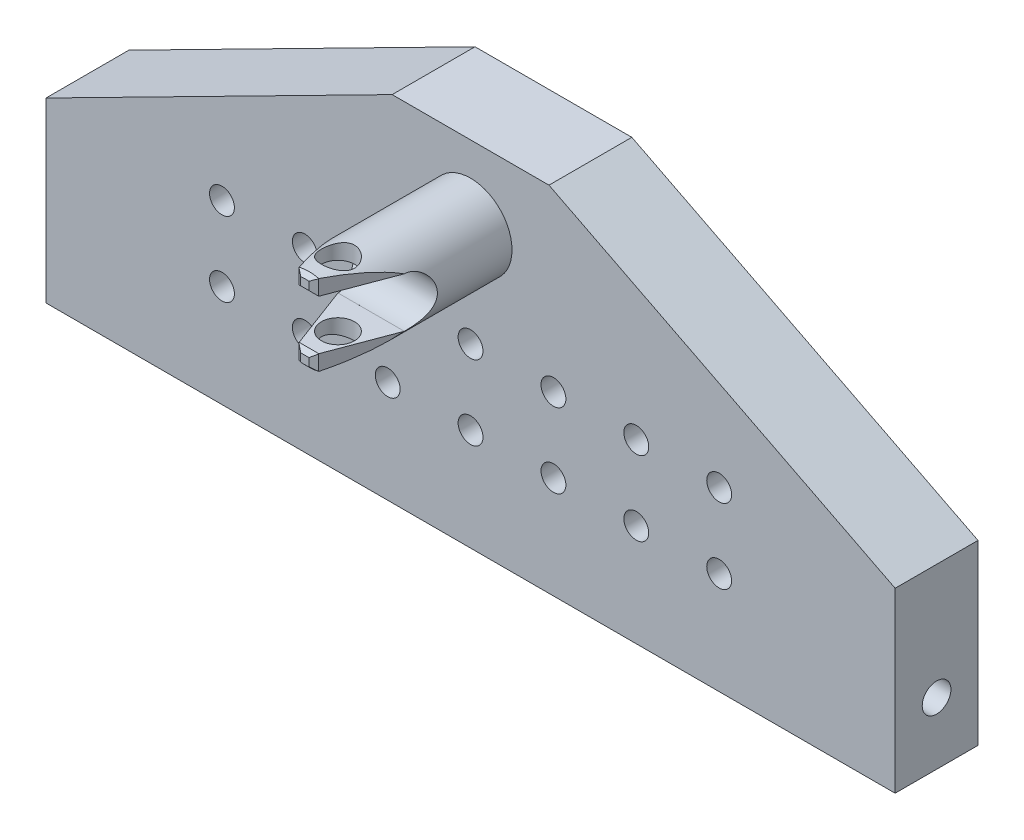
from build123d import *

# Parameters (mm, degrees)
BOSS_EXTRUDE1_DEPTH = 10
SKETCH10_R          = 1.5
CUT_EXTRUDE9_DEPTH  = 20
SKETCH11_R          = 1.730599661
CUT_EXTRUDE10_DEPTH = 112.446287057
SKETCH12_R          = 5
BOSS_EXTRUDE4_DEPTH = 20
CUT_EXTRUDE11_START = -10.000002096
CUT_EXTRUDE11_DEPTH = 10.000002096
SKETCH14_R          = 2
CUT_EXTRUDE12_DEPTH = 71.851658179
CHAMFER1_SIZE       = 0.5


# Read off the part's stored shape, not the designer's step: Cut-Extrude11
with BuildPart() as part:
    # Sketch1 → Boss-Extrude1 (new body)
    with BuildSketch(Plane.XY):
        Polygon((51.23475383, 0), (51.23475383, 21.423100566), (9.462915873, 42.664679757), (-9.462915873, 42.664679757), (-51.23475383, 21.423100566), (-51.23475383, 0), align=None)
    extrude(amount=BOSS_EXTRUDE1_DEPTH)

    # Sketch10 → Cut-Extrude9 (cut)
    with BuildSketch(Plane(origin=(0, 0, 0), x_dir=(-1, 0, 0), z_dir=(0, 0, -1))):
        with Locations((0, 21.332339879)):
            Circle(SKETCH10_R)
        with Locations((10, 21.332339879)):
            Circle(SKETCH10_R)
        with Locations((20, 21.332339879)):
            Circle(SKETCH10_R)
        with Locations((30, 21.332339879)):
            Circle(SKETCH10_R)
        with Locations((-10, 21.332339879)):
            Circle(SKETCH10_R)
        with Locations((-20, 21.332339879)):
            Circle(SKETCH10_R)
        with Locations((-30, 21.332339879)):
            Circle(SKETCH10_R)
        with Locations((10, 12.332339879)):
            Circle(SKETCH10_R)
        with Locations((0, 12.332339879)):
            Circle(SKETCH10_R)
        with Locations((20, 12.332339879)):
            Circle(SKETCH10_R)
        with Locations((30, 12.332339879)):
            Circle(SKETCH10_R)
        with Locations((-10, 12.332339879)):
            Circle(SKETCH10_R)
        with Locations((-20, 12.332339879)):
            Circle(SKETCH10_R)
        with Locations((-30, 12.332339879)):
            Circle(SKETCH10_R)
    extrude(amount=-CUT_EXTRUDE9_DEPTH, mode=Mode.SUBTRACT)

    # Sketch11 → Cut-Extrude10 (cut, through all)
    with BuildSketch(Plane(origin=(51.23475383, 0, 0), x_dir=(0, 0, -1), z_dir=(1, 0, 0))):
        with Locations(Location((-5, 7.5, 0), (0, 0, 90))):
            Circle(SKETCH11_R)
    extrude(amount=-CUT_EXTRUDE10_DEPTH, mode=Mode.SUBTRACT)

    # Sketch12 → Boss-Extrude4 (add)
    with BuildSketch(Plane.XY.offset(10)):
        with Locations((0, 33.664679757)):
            Circle(SKETCH12_R)
    extrude(amount=BOSS_EXTRUDE4_DEPTH)

    # Cut-Extrude11 outline → Cut-Extrude11 (cut)
    with BuildSketch(Plane(origin=(5, 0, 0), x_dir=(0, 0, -1), z_dir=(1, 0, 0)).offset(CUT_EXTRUDE11_START)):
        with BuildLine():
            ThreePointArc((-22, 30.665551075), (-19.000871318, 33.664679757), (-22, 36.663808439))
            Line((-22, 36.663808439), (-22, 36.664679757))
            Line((-22, 36.664679757), (-30, 36.664679757))
            Line((-30, 36.664679757), (-30, 30.664679757))
            Line((-30, 30.664679757), (-22, 30.664679757))
            Line((-22, 30.664679757), (-22, 30.665551075))
        make_face()
    extrude(amount=CUT_EXTRUDE11_DEPTH, mode=Mode.SUBTRACT)

    # Sketch14 → Cut-Extrude12 (cut, through all)
    with BuildSketch(Plane(origin=(0, 38.664679757, 0), x_dir=(1, 0, 0), z_dir=(0, 1, 0))):
        with Locations(Location((0, -26, 0), (0, 0, 270))):
            Circle(SKETCH14_R)
        Polygon((-4.00065334, -22), (-1, -30), (-4, -30), align=None)
        Polygon((1, -30), (4, -30), (4.00065334, -22), align=None)
    extrude(amount=-CUT_EXTRUDE12_DEPTH, mode=Mode.SUBTRACT)

    # Chamfer1
    chamfer1_edges = [part.edges().sort_by_distance(p)[0] for p in [
        (1, 29.715190014, 30),
        (1, 37.6141695, 30),
        (0, 36.664679757, 30),
        (0, 28.664679757, 30),
        (0, 38.664679757, 30),
        (0, 30.664679757, 30),
        (-1, 29.715190014, 30),
        (-1, 37.6141695, 30),
    ]]
    chamfer(chamfer1_edges, length=CHAMFER1_SIZE)


solid = part.part
